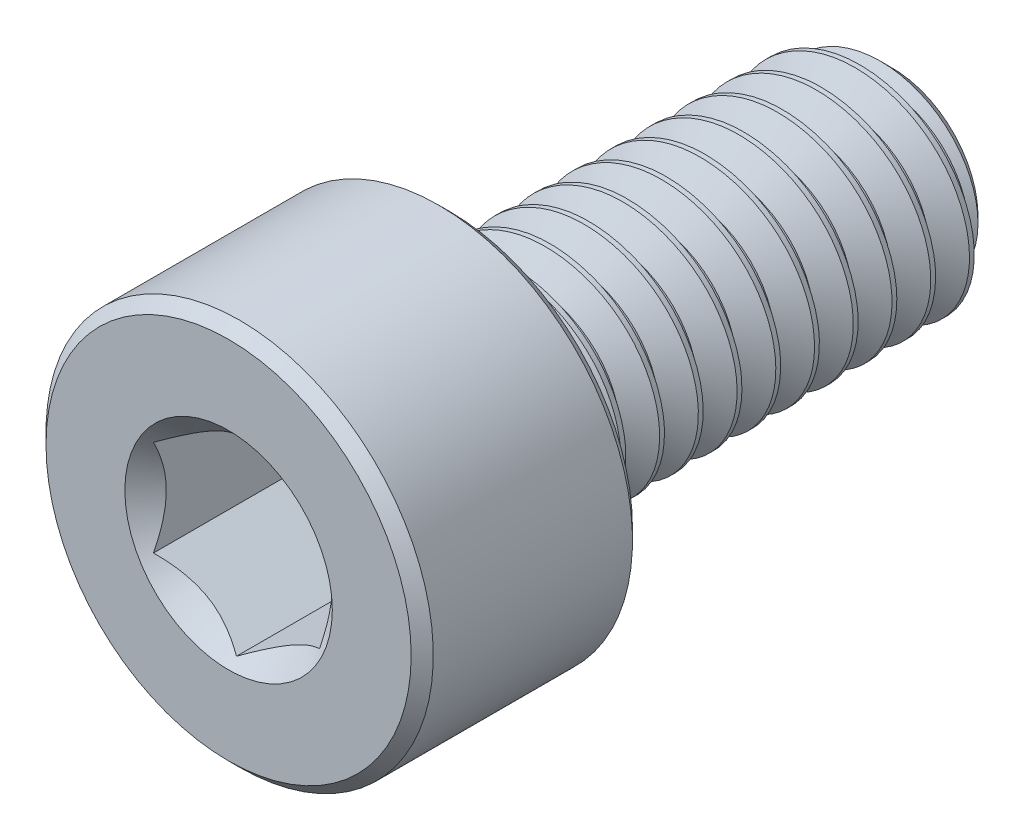
from build123d import *

# Parameters (mm, degrees)
CUT_EXTRUDE1_DEPTH     = 3
SPLIT1_SURFACE_1_BACK  = 16.556
SPLIT1_SURFACE_1_DEPTH = 33.112
SPLIT1_SURFACE_2_BACK  = 16.556
SPLIT1_SURFACE_2_DEPTH = 33.112
CUT_SWEEP1_PITCH       = 0.7


with BuildPart() as part:
    # Sketch2 → Revolve1 (revolve)
    with BuildSketch(Plane(origin=(0, 0, 0), x_dir=(0, 0, -1), z_dir=(1, 0, 0))):
        with BuildLine():
            Line((-6, 0), (-6, 3.3))
            Line((-6, 3.3), (-5.8, 3.5))
            Line((-5.8, 3.5), (-2.2, 3.5))
            Line((-2.2, 3.5), (-2, 3.3))
            Line((-2, 3.3), (-2, 2.2))
            ThreePointArc((-2, 2.2), (-1.941421356, 2.058578644), (-1.8, 2))
            Line((-1.8, 2), (5.545336663, 2))
            Line((5.545336663, 2), (6, 1.545336663))
            Line((6, 1.545336663), (6, 0))
            Line((6, 0), (-6, 0))
        make_face()
    revolve(axis=Axis((0, 0, -6), (0, 0, 1)))

    # Sketch3 → Cut-Extrude1 (cut)
    with BuildSketch(Plane.XY.offset(6)):
        Polygon((1.5, -0.866025404), (1.5, 0.866025404), (0, 1.732050808), (-1.5, 0.866025404), (-1.5, -0.866025404), (0, -1.732050808), align=None)
    extrude(amount=-CUT_EXTRUDE1_DEPTH, mode=Mode.SUBTRACT)

    # Cut-Extrude2 cone 1 section (through the dimple's axis) → Cut-Extrude2 (revolve, cut)
    with BuildSketch(Plane(origin=(0, 0, 6), x_dir=(0, -1, 0), z_dir=(1, 0, 0))):
        Polygon((0, 0), (1.875, 0), (0, 1.875), align=None)
    revolve(axis=Axis((0, 0, 6), (0, 0, -1)), mode=Mode.SUBTRACT)


with BuildPart() as body_2:
    # Split1: the piece behind the surface
    add(part.part)
    # Split1 surface: a surface, the sketch's curves swept straight by 33.112 mm
    with BuildLine(Plane(origin=(0, 0, 0), x_dir=(0, 0, -1), z_dir=(1, 0, 0)).offset(-SPLIT1_SURFACE_1_BACK), mode=Mode.PRIVATE) as split1_surface_1_path:
        Line((-1.8, -3.5), (-1.8, 3.5))
    split1_surface_1 = Shell.extrude(split1_surface_1_path.wire(), (1 * SPLIT1_SURFACE_1_DEPTH, 0 * SPLIT1_SURFACE_1_DEPTH, 0 * SPLIT1_SURFACE_1_DEPTH))
    split(bisect_by=split1_surface_1, keep=Keep.BOTTOM)

    # Cut-Sweep1: the profile of Sketch7 screwed along a right-hand helix of 12.428571 turns, 6 arcs to a turn; built about Z, then put on its axis
    cut_sweep1_z = Axis((0, 0, 0), (0, 0, 1))
    cut_sweep1_corners = [(2.037888611, 0, 0.021875), (2.037888611, 0, -0.634375), (1.545336663, 0, -0.35), (1.545336663, 0, -0.2625)]
    with BuildLine(mode=Mode.PRIVATE) as cut_sweep1_profile:
        Line(cut_sweep1_corners[0], cut_sweep1_corners[1])
        Line(cut_sweep1_corners[1], cut_sweep1_corners[2])
        Line(cut_sweep1_corners[2], cut_sweep1_corners[3])
        Line(cut_sweep1_corners[3], cut_sweep1_corners[0])
    cut_sweep1_cap = Face(cut_sweep1_profile.wire())
    cut_sweep1_turn_angles = [0, 30, 60, 90, 120, 150, 180, 210, 240, 270, 300, 330, 360]
    cut_sweep1_turn_weights = [1, 0.8660254037844387, 1, 0.8660254037844387, 1, 0.8660254037844387, 1, 0.8660254037844387, 1, 0.8660254037844387, 1, 0.8660254037844387, 1]
    cut_sweep1_turn_rails = [Edge.make_bspline([Vector(p[0], p[1], 0).rotate(cut_sweep1_z, cut_sweep1_turn_angles[k]) / cut_sweep1_turn_weights[k] + Vector(0, 0, p[2] + CUT_SWEEP1_PITCH * cut_sweep1_turn_angles[k] / 360) for k in range(13)], [0, 0, 0, 1, 1, 2, 2, 3, 3, 4, 4, 5, 5, 6, 6, 6], 2, cut_sweep1_turn_weights) for p in cut_sweep1_corners]
    cut_sweep1_turn_sides = [Face.make_surface_from_curves(cut_sweep1_turn_rails[p[0]], cut_sweep1_turn_rails[p[1]]) for p in [(0, 1), (1, 2), (2, 3), (3, 0)]]
    cut_sweep1_last_angles = [4320, 4350, 4380, 4410, 4440, 4457.142857143, 4474.285714286]
    cut_sweep1_last_weights = [1, 0.8660254037844387, 1, 0.8660254037844387, 1, 0.9555728057861561, 1]
    cut_sweep1_last_rails = [Edge.make_bspline([Vector(p[0], p[1], 0).rotate(cut_sweep1_z, cut_sweep1_last_angles[k]) / cut_sweep1_last_weights[k] + Vector(0, 0, p[2] + CUT_SWEEP1_PITCH * cut_sweep1_last_angles[k] / 360) for k in range(7)], [0, 0, 0, 1, 1, 2, 2, 3, 3, 3], 2, cut_sweep1_last_weights) for p in cut_sweep1_corners]
    cut_sweep1_last_sides = [Face.make_surface_from_curves(cut_sweep1_last_rails[p[0]], cut_sweep1_last_rails[p[1]]) for p in [(0, 1), (1, 2), (2, 3), (3, 0)]]
    cut_sweep1 = Plane(origin=(0, 0, -6), x_dir=(0, 1, 0), z_dir=(0, 0, 1)) * Solid(Shell([*[p.moved(Location((0, 0, CUT_SWEEP1_PITCH * i))) for i in range(12) for p in cut_sweep1_turn_sides], *cut_sweep1_last_sides, cut_sweep1_cap, cut_sweep1_cap.rotate(cut_sweep1_z, 4474.285714286).moved(Location((0, 0, CUT_SWEEP1_PITCH * 4474.285714286 / 360)))]))
    add(cut_sweep1, mode=Mode.SUBTRACT)


with BuildPart() as part_1:
    add(part.part)

    # Split1: split by a surface, the side it looks to stays
    # Split1 surface: a surface, the sketch's curves swept straight by 33.112 mm
    with BuildLine(Plane(origin=(0, 0, 0), x_dir=(0, 0, -1), z_dir=(1, 0, 0)).offset(-SPLIT1_SURFACE_2_BACK), mode=Mode.PRIVATE) as split1_surface_2_path:
        Line((-1.8, -3.5), (-1.8, 3.5))
    split1_surface_2 = Shell.extrude(split1_surface_2_path.wire(), (1 * SPLIT1_SURFACE_2_DEPTH, 0 * SPLIT1_SURFACE_2_DEPTH, 0 * SPLIT1_SURFACE_2_DEPTH))
    split(bisect_by=split1_surface_2, keep=Keep.TOP)

    add(body_2.part)  # Revolve2 merges body 2
    # Sketch8 → Revolve2 (revolve)
    with BuildSketch(Plane(origin=(0, 0, 0), x_dir=(0, 0, -1), z_dir=(1, 0, 0)), mode=Mode.PRIVATE) as revolve2_sk:
        Polygon((-2, 0), (-2, 2), (-1.8, 2), (-0.645299462, 0), align=None)
    revolve(revolve2_sk.sketch.rotate(Axis((0, 0, 0.645299462), (0, 0, 1)), 270), axis=Axis((0, 0, 0.645299462), (0, 0, 1)))


solid = part_1.part
